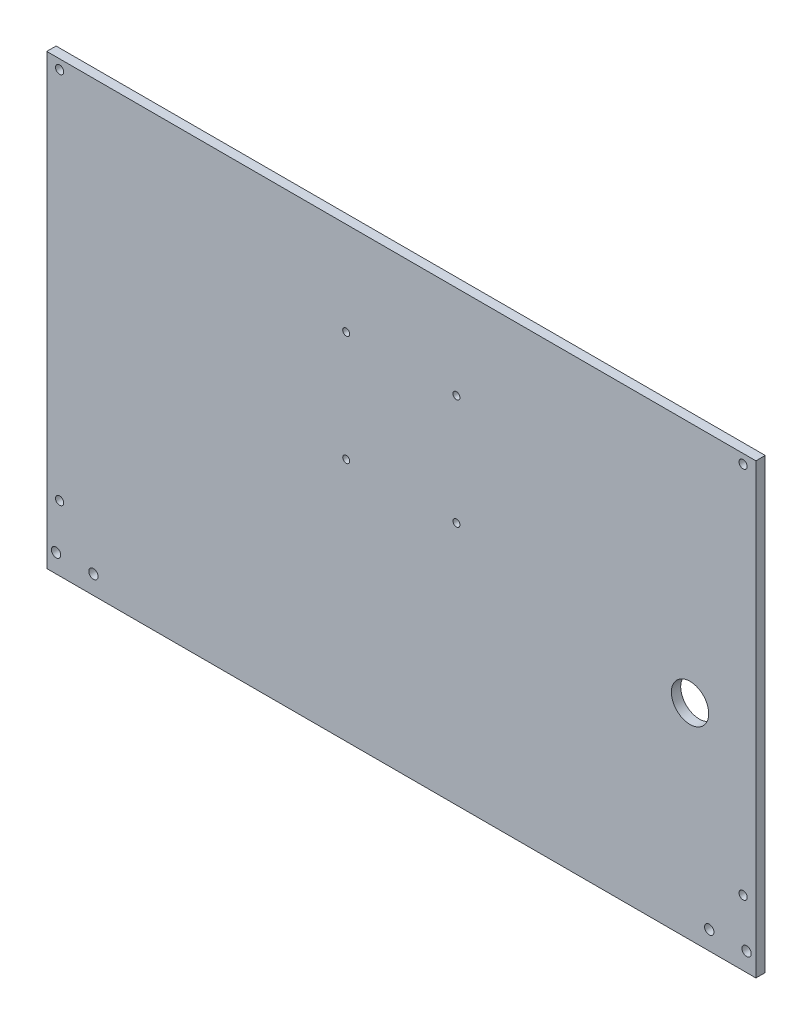
from build123d import *

# Parameters (mm, degrees)
SKETCH1_W           = 482.6
SKETCH1_H           = 304.8
BOSS_EXTRUDE1_DEPTH = 6.35
SKETCH2_R           = 2.7813
CUT_EXTRUDE1_DEPTH  = 286.467638271
SKETCH3_R           = 3.175
CUT_EXTRUDE2_DEPTH  = 286.467638271
SKETCH4_R           = 12.7
CUT_EXTRUDE3_DEPTH  = 286.467638271
SKETCH5_R           = 2.3749
CUT_EXTRUDE4_DEPTH  = 286.467638271


with BuildPart() as part:
    # Sketch1 → Boss-Extrude1 (new body)
    with BuildSketch(Plane.XY):
        Rectangle(SKETCH1_W, SKETCH1_H)
    extrude(amount=BOSS_EXTRUDE1_DEPTH)

    # Sketch2 → Cut-Extrude1 (cut, through all)
    with BuildSketch(Plane.XY.offset(6.35)):
        with Locations((-232.5624, 146.05)):
            Circle(SKETCH2_R)
        with Locations((-232.5624, -107.95)):
            Circle(SKETCH2_R)
    cut_extrude1 = extrude(amount=-CUT_EXTRUDE1_DEPTH, mode=Mode.SUBTRACT)

    # Mirror1: Cut-Extrude1 across plane
    add(cut_extrude1.mirror(Plane(origin=(0, 0, 0), x_dir=(0, 0, 1), z_dir=(1, 0, 0))), mode=Mode.SUBTRACT)

    # Sketch3 → Cut-Extrude2 (cut, through all)
    with BuildSketch(Plane.XY.offset(6.35)):
        with Locations((-234.95, -139.7)):
            Circle(SKETCH3_R)
        with Locations((-209.55, -139.7)):
            Circle(SKETCH3_R)
    cut_extrude2 = extrude(amount=-CUT_EXTRUDE2_DEPTH, mode=Mode.SUBTRACT)

    # Mirror2: Cut-Extrude2 across plane
    add(cut_extrude2.mirror(Plane(origin=(0, 0, 0), x_dir=(0, 0, 1), z_dir=(1, 0, 0))), mode=Mode.SUBTRACT)

    # Sketch4 → Cut-Extrude3 (cut, through all)
    with BuildSketch(Plane.XY.offset(6.35)):
        with Locations((196.469, -12.7)):
            Circle(SKETCH4_R)
    extrude(amount=-CUT_EXTRUDE3_DEPTH, mode=Mode.SUBTRACT)

    # Sketch5 → Cut-Extrude4 (cut, through all)
    with BuildSketch(Plane.XY.offset(6.35)):
        with Locations((-37.5, 88.9)):
            Circle(SKETCH5_R)
        with Locations((37.5, 88.9)):
            Circle(SKETCH5_R)
        with Locations((37.5, 13.9)):
            Circle(SKETCH5_R)
        with Locations((-37.5, 13.9)):
            Circle(SKETCH5_R)
    extrude(amount=-CUT_EXTRUDE4_DEPTH, mode=Mode.SUBTRACT)


solid = part.part
